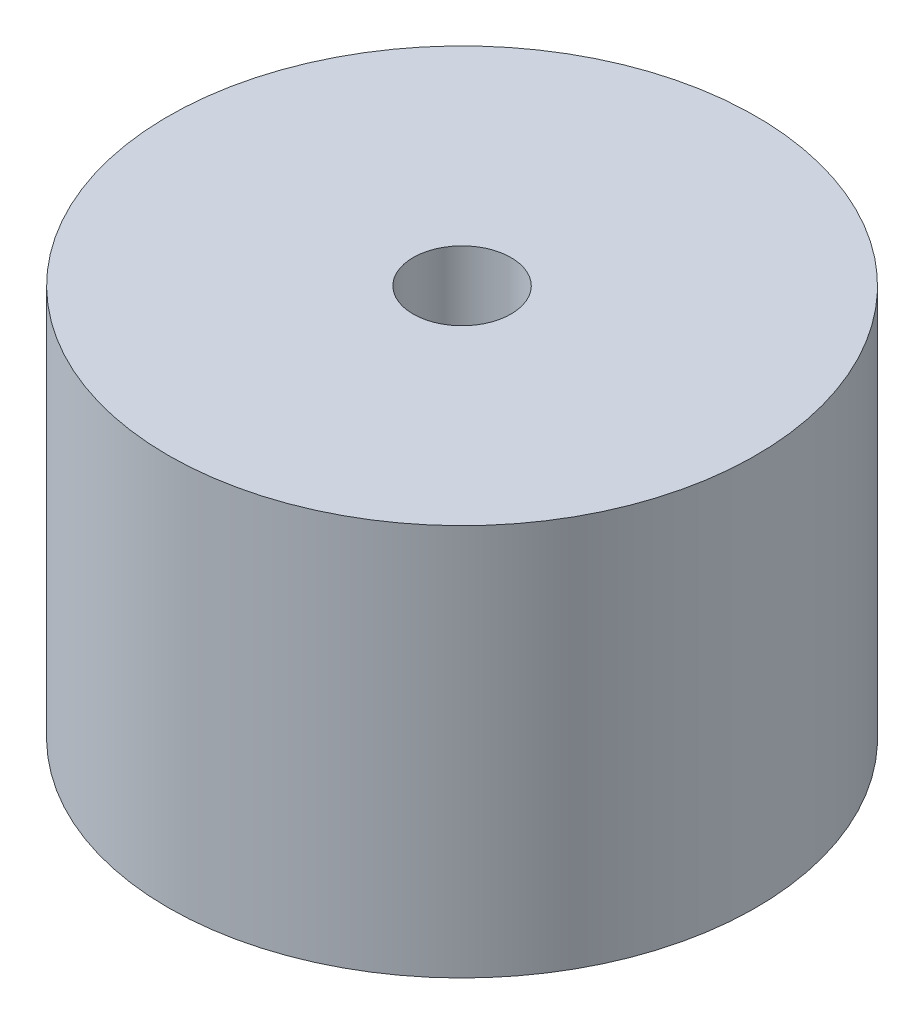
from build123d import *

# Parameters (mm, degrees)
SKETCH1_R           = 9
SKETCH1_R_2         = 1.5
BOSS_EXTRUDE1_DEPTH = 12


with BuildPart() as part:
    # Sketch1 → Boss-Extrude1 (new body)
    with BuildSketch(Plane(origin=(0, 0, 0), x_dir=(1, 0, 0), z_dir=(0, 1, 0))):
        Circle(SKETCH1_R)
        Circle(SKETCH1_R_2, mode=Mode.SUBTRACT)
    extrude(amount=BOSS_EXTRUDE1_DEPTH)


solid = part.part
